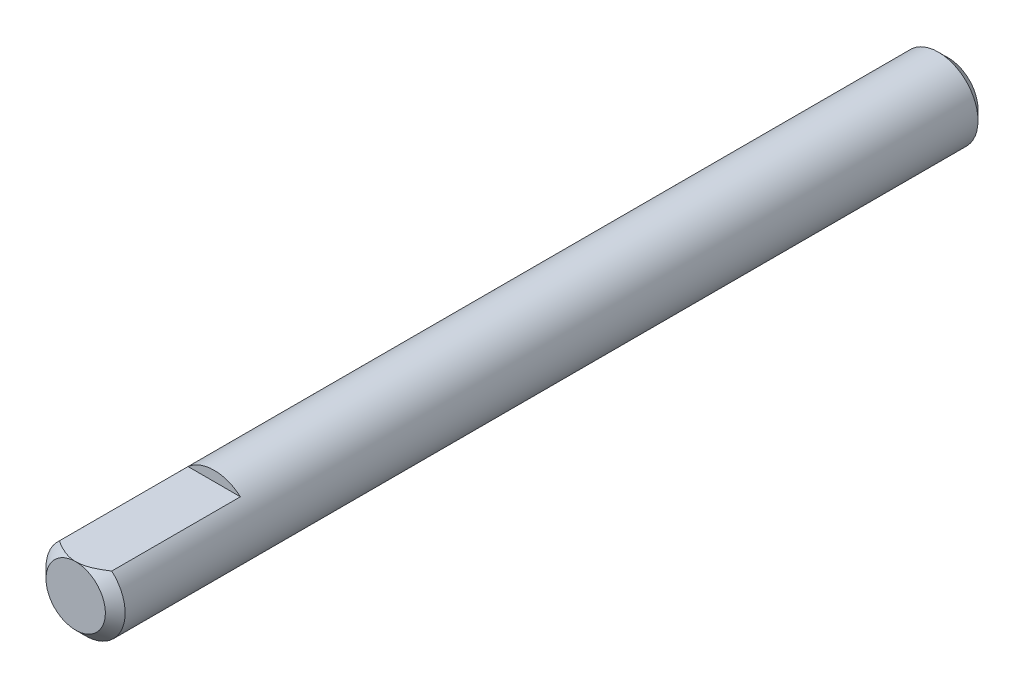
from build123d import *

# Parameters (mm, degrees)
SKETCH_2_R          = 2
EXTRUDE_1_DEPTH     = 44.1
CUT_EXTRUDE_START   = -7
CUT_EXTRUDE_1_DEPTH = 7
CHAMFER_1_SIZE      = 0.5
CHAMFER_2_SIZE      = 0.5


with BuildPart() as part:
    # Эскиз2 → Бобышка-Вытянуть1 (new body)
    with BuildSketch(Plane.XY):
        Circle(SKETCH_2_R)
    extrude(amount=EXTRUDE_1_DEPTH)

    # Эскиз3 → Вырез-Вытянуть1 (cut)
    with BuildSketch(Plane.XY.offset(44.1).offset(CUT_EXTRUDE_START)):
        with BuildLine():
            Line((1.322875656, 1.5), (-1.322875656, 1.5))
            ThreePointArc((-1.322875656, 1.5), (0, 2), (1.322875656, 1.5))
        make_face()
    extrude(amount=CUT_EXTRUDE_1_DEPTH, mode=Mode.SUBTRACT)

    # Фаска1
    chamfer_1_edges = [part.edges().sort_by_distance(p)[0] for p in [
        (-2, 0, 0),
    ]]
    chamfer(chamfer_1_edges, length=CHAMFER_1_SIZE)

    # Фаска2
    chamfer_2_edges = [part.edges().sort_by_distance(p)[0] for p in [
        (-0.822875656, -1.822875656, 44.1),
    ]]
    chamfer(chamfer_2_edges, length=CHAMFER_2_SIZE - 0.0001)  # a hair under: the kernel refuses the full size


solid = part.part
